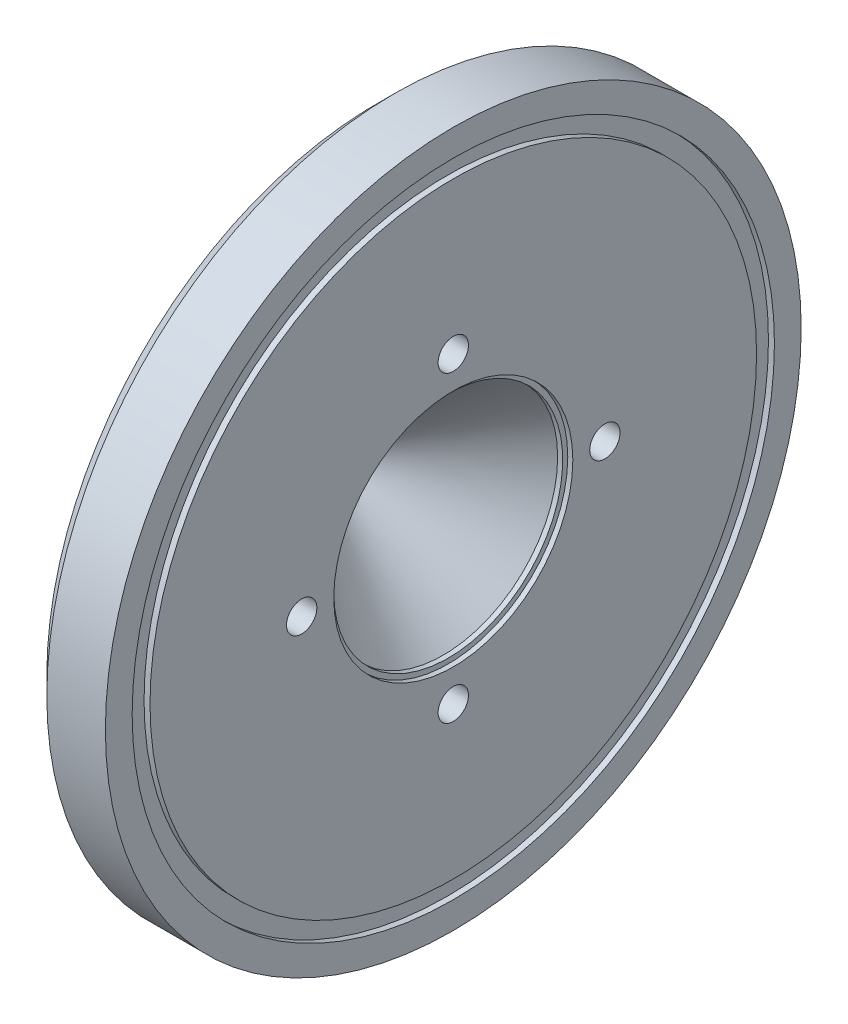
from build123d import *

# Parameters (mm, degrees)
CBORE_FOR_M3_HEX_SOCKET_HEAD_CAP_SCREW2_D           = 3.4
CBORE_FOR_M3_HEX_SOCKET_HEAD_CAP_SCREW2_DEPTH       = 8.566
CBORE_FOR_M3_HEX_SOCKET_HEAD_CAP_SCREW2_CBORE_D     = 6.5
CBORE_FOR_M3_HEX_SOCKET_HEAD_CAP_SCREW2_CBORE_DEPTH = 3.4
CBORE_FOR_M3_HEX_SOCKET_HEAD_CAP_SCREW2_TIP         = 1.021463052
CHAMFER1_SIZE                                       = 2


with BuildPart() as part:
    # Sketch1 → Revolve17 (revolve)
    with BuildSketch(Plane.XY):
        Polygon((-14.175209939, 3.15), (-14.175209939, 3.65), (-18.508543272, 3.15), (-18.508543272, 1.9), (0, 1.9), (12.030253634, 12.834), (12.596253634, 12.834), (12.596253634, 13.4), (13.162253634, 13.4), (13.162253634, 34), (12.495253634, 34), (12.495253634, 36), (13.162253634, 36), (13.162253634, 39), (4.596253634, 39), (4.596253634, 12.834), (-5.508543272, 3.65), (-9.841876606, 3.15), (-9.841876606, 3.65), align=None)
    revolve(axis=Axis((-801.920554309, 0, 0), (1, 0, 0)))

    # CBORE for M3 Hex Socket Head Cap Screw2
    with Locations(Plane.ZY.offset(-4.596253634)):
        with Locations((0, -16.994664238), (0, 16.994664238), (16.994664238, 0), (-16.994664238, 0)):
            CounterBoreHole(CBORE_FOR_M3_HEX_SOCKET_HEAD_CAP_SCREW2_D / 2, CBORE_FOR_M3_HEX_SOCKET_HEAD_CAP_SCREW2_CBORE_D / 2, CBORE_FOR_M3_HEX_SOCKET_HEAD_CAP_SCREW2_CBORE_DEPTH, depth=CBORE_FOR_M3_HEX_SOCKET_HEAD_CAP_SCREW2_DEPTH)
            with Locations((0, 0, -(CBORE_FOR_M3_HEX_SOCKET_HEAD_CAP_SCREW2_DEPTH + CBORE_FOR_M3_HEX_SOCKET_HEAD_CAP_SCREW2_TIP / 2))):  # 118° drill point
                Cone(0, CBORE_FOR_M3_HEX_SOCKET_HEAD_CAP_SCREW2_D / 2, CBORE_FOR_M3_HEX_SOCKET_HEAD_CAP_SCREW2_TIP, mode=Mode.SUBTRACT)

    # Chamfer1
    chamfer1_edges = [part.edges().sort_by_distance(p)[0] for p in [
        (4.596253634, -39, 0),
    ]]
    chamfer(chamfer1_edges, length=CHAMFER1_SIZE)


solid = part.part
